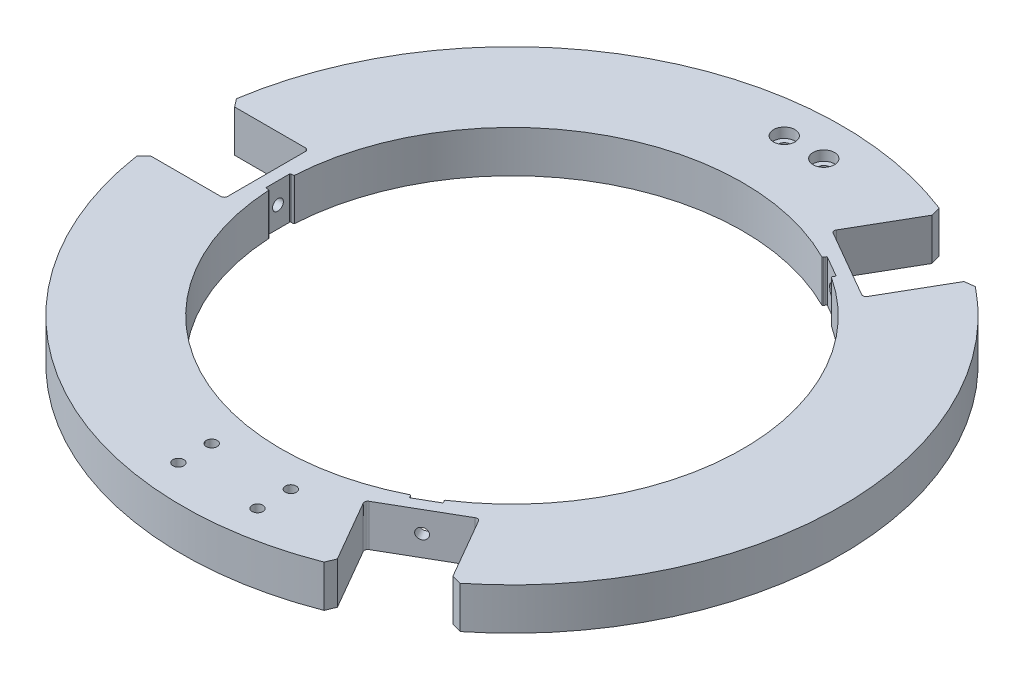
from build123d import *

# Parameters (mm, degrees)
SKETCH1_R                      = 70
BOSS_EXTRUDE2_DEPTH            = 12.7
FILLET1_R                      = 1
CHAMFER1_SIZE                  = 2.232593028
CHAMFER1_SIZE_2                = 2.5
F_3_0MM_DOWEL_HOLE2_REACH      = 215.907
F_3_0MM_DOWEL_HOLE2_BORE_R     = 1.65
CIRPATTERN3_COUNT              = 3
SKETCH8_W                      = 2
SKETCH8_H                      = 7.5
CUT_EXTRUDE1_DEPTH             = 142.990457435
FILLET2_R                      = 0.25
CIRPATTERN4_COUNT              = 3
FILLET2_OF_CIRPATTERN4_R       = 0.25
CBORE_FOR_M3_SHCS1_D           = 3.4
CBORE_FOR_M3_SHCS1_DEPTH       = 25.25
CBORE_FOR_M3_SHCS1_CBORE_D     = 6.5
CBORE_FOR_M3_SHCS1_CBORE_DEPTH = 3
CBORE_FOR_M3_SHCS1_TIP         = 1.021463052
F_3_0MM_DOWEL_HOLE3_D          = 3.3
F_3_0MM_DOWEL_HOLE3_DEPTH      = 45
F_3_0MM_DOWEL_HOLE3_TIP        = 0.991420021


with BuildPart() as part:
    # Sketch1 → Boss-Extrude2 (new body)
    with BuildSketch(Plane(origin=(0, 0, 0), x_dir=(1, 0, 0), z_dir=(0, 1, 0))):
        with BuildLine():
            ThreePointArc((100, 0), (89.630863423, 44.343075243), (60.673833561, 79.490162417))
            Line((60.673833561, 79.490162417), (48.335125168, 58.118892582))
            Line((48.335125168, 58.118892582), (26.164874832, 70.918892582))
            Line((26.164874832, 70.918892582), (38.503583224, 92.290162417))
            ThreePointArc((38.503583224, 92.290162417), (-50, 86.602540378), (-99.177416784, 12.8))
            Line((-99.177416784, 12.8), (-74.5, 12.8))
            Line((-74.5, 12.8), (-74.5, -12.8))
            Line((-74.5, -12.8), (-99.177416784, -12.8))
            ThreePointArc((-99.177416784, -12.8), (-50, -86.602540378), (38.503583224, -92.290162417))
            Line((38.503583224, -92.290162417), (26.164874832, -70.918892582))
            Line((26.164874832, -70.918892582), (48.335125168, -58.118892582))
            Line((48.335125168, -58.118892582), (60.673833561, -79.490162417))
            ThreePointArc((60.673833561, -79.490162417), (89.630863423, -44.343075243), (100, 0))
        make_face()
        with Locations(Location((0, 0, 0), (0, 0, 270))):
            Circle(SKETCH1_R, mode=Mode.SUBTRACT)
    extrude(amount=BOSS_EXTRUDE2_DEPTH)

    # Fillet1
    fillet1_edges = [part.edges().sort_by_distance(p)[0] for p in [
        (48.335125168, 6.35, 58.118892582),
        (26.164874832, 6.35, 70.918892582),
        (-74.5, 6.35, 12.8),
        (-74.5, 6.35, -12.8),
        (26.164874832, 6.35, -70.918892582),
        (48.335125168, 6.35, -58.118892582),
    ]]
    fillet(fillet1_edges, radius=FILLET1_R)

    # Chamfer1
    # the kernel refuses this chamfer: 2.5, 2.232593028 mm, written as the material it takes off along each edge
    with BuildSketch(Plane(origin=(38.503583224, -6.351330223, 92.290162417), x_dir=(-0.4999999999994457, 0, -0.8660254037847587), z_dir=(0, 1, 0)), Plane(origin=(60.673833561, -6.351330223, -79.490162417), x_dir=(-0.5000000000003051, 0, 0.8660254037842624), z_dir=(0, 1, 0))) as chamfer1_piece_1:
        with BuildLine():
            Line((CHAMFER1_SIZE, 0), (0.346342416, 2.445285803))
            ThreePointArc((0.346342416, 2.445285803), (0.170523224, 1.258272567), (0, 0))
            Line((0, 0), (CHAMFER1_SIZE, 0))
        make_face()
    extrude(amount=25.402660447, mode=Mode.SUBTRACT)
    with BuildSketch(Plane(origin=(-99.177416784, -6.42920747, 12.8), x_dir=(0.13897023449143497, 0, 0.990296558574953), z_dir=(0, 1, 0)), Plane(origin=(60.673833561, -6.42920747, 79.490162417), x_dir=(0.7881368597604604, 0, -0.6155000327269856), z_dir=(0, 1, 0))) as chamfer1_piece_2:
        with BuildLine():
            Line((2.213825834, 0), (CHAMFER1_SIZE_2 * 0.138970234491, CHAMFER1_SIZE_2 * 0.990296558575))
            Line((CHAMFER1_SIZE_2 * 0.138970234491, CHAMFER1_SIZE_2 * 0.990296558575), (0, 0))
            ThreePointArc((0, 0), (1.137001677, -0.006121942), (2.213825834, 0))
        make_face()
    extrude(amount=25.55841494, mode=Mode.SUBTRACT)
    with BuildSketch(Plane(origin=(-99.177416784, -6.351330223, -12.8), x_dir=(0.1402371214073107, 0, -0.9901179474079799), z_dir=(0, 1, 0))) as chamfer1_piece_3:
        with BuildLine():
            Line((2.469691423, 0), (CHAMFER1_SIZE * 0.140237121404, -CHAMFER1_SIZE * 0.990117947384))
            Line((CHAMFER1_SIZE * 0.140237121404, -CHAMFER1_SIZE * 0.990117947384), (0, 0))
            ThreePointArc((0, 0), (1.269751938, 0.007618418), (2.469691423, 0))
        make_face()
    extrude(amount=25.402660447, mode=Mode.SUBTRACT)
    with BuildSketch(Plane(origin=(38.503583224, -6.42920747, -92.290162417), x_dir=(-0.49999999999948913, 0, 0.8660254037847336), z_dir=(0, 1, 0))) as chamfer1_piece_4:
        with BuildLine():
            Line((CHAMFER1_SIZE_2, 0), (0.307655895, -2.192344105))
            ThreePointArc((0.307655895, -2.192344105), (0.151946852, -1.126819615), (0, 0))
            Line((0, 0), (CHAMFER1_SIZE_2, 0))
        make_face()
    extrude(amount=25.55841494, mode=Mode.SUBTRACT)

    # Ø3.0mm Dowel Hole2 bore → Ø3.0mm Dowel Hole2 (cut, up to next)
    with BuildSketch(Plane(origin=(37.25, 0, 64.518892582), x_dir=(0.8660254037844382, 0, -0.500000000000001), z_dir=(0.5000000000000009, 0, 0.866025403784438)), mode=Mode.PRIVATE) as f_3_0mm_dowel_hole2_sk1:
        with Locations((0, 6.35)):
            Circle(F_3_0MM_DOWEL_HOLE2_BORE_R)
    f_3_0mm_dowel_hole2_tool1 = extrude(f_3_0mm_dowel_hole2_sk1.sketch, amount=-F_3_0MM_DOWEL_HOLE2_REACH, mode=Mode.PRIVATE) & part.part
    f_3_0mm_dowel_hole2 = f_3_0mm_dowel_hole2_tool1.solids().sort_by_distance((37.25, 6.35, 64.518893))[0]
    add(f_3_0mm_dowel_hole2, mode=Mode.SUBTRACT)

    # CirPattern3: Ø3.0mm Dowel Hole2 ×3 about axis
    cirpattern3_axis = Axis((0, 12.7, 0), (0, -1, 0))
    for i in range(1, CIRPATTERN3_COUNT):
        add(f_3_0mm_dowel_hole2.rotate(cirpattern3_axis, i * 360 / CIRPATTERN3_COUNT), mode=Mode.SUBTRACT)

    # Sketch8 → Cut-Extrude1 (cut, through all)
    with BuildSketch(Plane(origin=(0, 12.7, 0), x_dir=(1, 0, 0), z_dir=(0, 1, 0))):
        with Locations((-70, 0)):
            Rectangle(SKETCH8_W, SKETCH8_H)
    cut_extrude1 = extrude(amount=-CUT_EXTRUDE1_DEPTH, mode=Mode.SUBTRACT)

    # Fillet2
    fillet2_edges = [part.edges().sort_by_distance(p)[0] for p in [
        (-69.8994814, 6.35, 3.75),
        (-69.8994814, 6.35, -3.75),
        (-71, 6.35, 3.75),
        (-71, 6.35, -3.75),
    ]]
    fillet(fillet2_edges, radius=FILLET2_R)

    # CirPattern4: Cut-Extrude1 ×3 about axis
    cirpattern4_axis = Axis((0, 0, 0), (0, 1, 0))
    for i in range(1, CIRPATTERN4_COUNT):
        add(cut_extrude1.rotate(cirpattern4_axis, i * 360 / CIRPATTERN4_COUNT), mode=Mode.SUBTRACT)

    # Fillet2 of CirPattern4
    fillet2_of_cirpattern4_edges = [part.edges().sort_by_distance(p)[0] for p in [
        (38.197335964, 6.35, 58.659726604),
        (31.702145436, 6.35, 62.409726604),
        (38.747595264, 6.35, 59.612803669),
        (32.252404736, 6.35, 63.362803669),
        (31.702145436, 6.35, -62.409726604),
        (38.197335964, 6.35, -58.659726604),
        (32.252404736, 6.35, -63.362803669),
        (38.747595264, 6.35, -59.612803669),
    ]]
    fillet(fillet2_of_cirpattern4_edges, radius=FILLET2_OF_CIRPATTERN4_R)

    # CBORE for M3 SHCS1
    with Locations(Plane(origin=(0, 12.7, 0), x_dir=(1, 0, 0), z_dir=(0, 1, 0))):
        with Locations((6, 88.602076866), (-6, 88.602076866)):
            CounterBoreHole(CBORE_FOR_M3_SHCS1_D / 2, CBORE_FOR_M3_SHCS1_CBORE_D / 2, CBORE_FOR_M3_SHCS1_CBORE_DEPTH, depth=CBORE_FOR_M3_SHCS1_DEPTH)
            with Locations((0, 0, -(CBORE_FOR_M3_SHCS1_DEPTH + CBORE_FOR_M3_SHCS1_TIP / 2))):  # 118° drill point
                Cone(0, CBORE_FOR_M3_SHCS1_D / 2, CBORE_FOR_M3_SHCS1_TIP, mode=Mode.SUBTRACT)

    # Ø3.0mm Dowel Hole3
    with Locations(Plane(origin=(0, 12.7, 0), x_dir=(1, 0, 0), z_dir=(0, 1, 0))):
        with Locations((12, -79.094879733), (12, -89.196412484), (-12, -89.196412484), (-12, -79.094879733)):
            Hole(F_3_0MM_DOWEL_HOLE3_D / 2, depth=F_3_0MM_DOWEL_HOLE3_DEPTH)
            with Locations((0, 0, -(F_3_0MM_DOWEL_HOLE3_DEPTH + F_3_0MM_DOWEL_HOLE3_TIP / 2))):  # 118° drill point
                Cone(0, F_3_0MM_DOWEL_HOLE3_D / 2, F_3_0MM_DOWEL_HOLE3_TIP, mode=Mode.SUBTRACT)


solid = part.part
